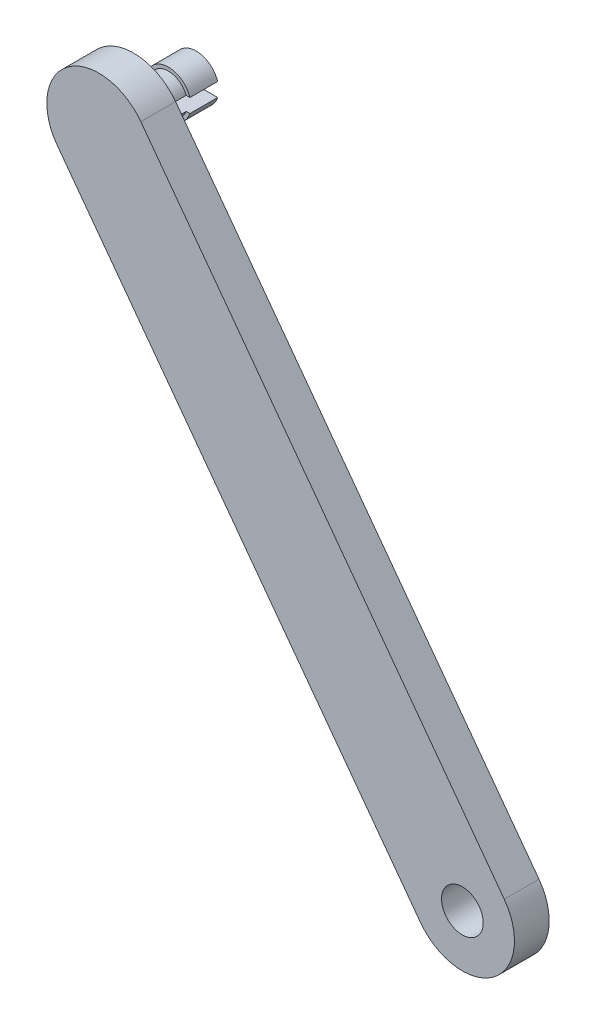
from build123d import *

# Parameters (mm, degrees)
BOSS_EXTRU_1_DEPTH      = 5
ESQUISSE2_R             = 3
ENL_V_MAT_EXTRU_1_DEPTH = 5
ESQUISSE3_R             = 2.75
BOSS_EXTRU_2_DEPTH      = 5
ESQUISSE4_R             = 3.25
BOSS_EXTRU_3_DEPTH      = 4
ESQUISSE5_W             = 10
ESQUISSE5_H             = 2
ENL_V_MAT_EXTRU_2_DEPTH = 9


with BuildPart() as part:
    # Esquisse1 → Boss.-Extru.1 (new body)
    with BuildSketch(Plane.XY):
        with BuildLine():
            Line((-6.031188803, -24.45811189), (-58.339701648, 46.307836729))
            ThreePointArc((-58.339701648, 46.307836729), (-56.766624736, 56.797137421), (-46.277324043, 55.224060509))
            Line((-46.277324043, 55.224060509), (6.031188803, -15.54188811))
            ThreePointArc((6.031188803, -15.54188811), (4.45811189, -26.031188803), (-6.031188803, -24.45811189))
        make_face()
    extrude(amount=BOSS_EXTRU_1_DEPTH)

    # Esquisse2 → Enlèv. mat.-Extru.1 (cut)
    with BuildSketch(Plane.XY.offset(5)):
        with Locations((0, -20)):
            Circle(ESQUISSE2_R)
    extrude(amount=-ENL_V_MAT_EXTRU_1_DEPTH, mode=Mode.SUBTRACT)

    # Esquisse3 → Boss.-Extru.2 (add)
    with BuildSketch(Plane(origin=(0, 0, 0), x_dir=(-1, 0, 0), z_dir=(0, 0, -1))):
        with Locations((52.308512845, 50.765948619)):
            Circle(ESQUISSE3_R)
    extrude(amount=BOSS_EXTRU_2_DEPTH)

    # Esquisse4 → Boss.-Extru.3 (add)
    with BuildSketch(Plane(origin=(0, 0, -5), x_dir=(-1, 0, 0), z_dir=(0, 0, -1))):
        with Locations((52.308512845, 50.765948619)):
            Circle(ESQUISSE4_R)
    extrude(amount=BOSS_EXTRU_3_DEPTH)

    # Esquisse5 → Enlèv. mat.-Extru.2 (cut)
    with BuildSketch(Plane(origin=(0, 0, -9), x_dir=(-1, 0, 0), z_dir=(0, 0, -1))):
        with Locations((52.308512845, 50.765948619)):
            Rectangle(ESQUISSE5_W, ESQUISSE5_H)
    extrude(amount=-ENL_V_MAT_EXTRU_2_DEPTH, mode=Mode.SUBTRACT)


solid = part.part
